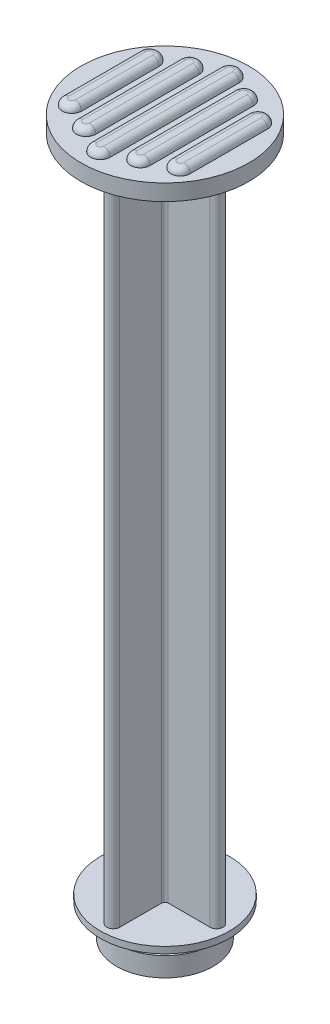
from build123d import *

# Parameters (mm, degrees)
BOSS_EXTRUDE1_DEPTH = 102
SKETCH3_R           = 13
BOSS_EXTRUDE2_DEPTH = 2.5
BOSS_EXTRUDE3_DEPTH = 1
FILLET1_R           = 1


with BuildPart() as part:
    # Sketch1 → Revolve1 (revolve)
    with BuildSketch(Plane.XY, mode=Mode.PRIVATE) as revolve1_sk:
        Polygon((0, 0), (7.5, 0), (7.5, 3), (6, 3), (6, 5), (10, 5), (10, 6), (0, 6), align=None)
    revolve(revolve1_sk.sketch.rotate(Axis((0, 6, 0), (0, -1, 0)), 180), axis=Axis((0, 6, 0), (0, -1, 0)))

    # Sketch2 → Boss-Extrude1 (add)
    with BuildSketch(Plane(origin=(0, 6, 0), x_dir=(1, 0, 0), z_dir=(0, 1, 0))):
        with BuildLine():
            Line((-1, 8), (-1, 1.5))
            ThreePointArc((-1, 1.5), (-1.146446609, 1.146446609), (-1.5, 1))
            Line((-1.5, 1), (-8, 1))
            ThreePointArc((-8, 1), (-9, 0), (-8, -1))
            Line((-8, -1), (-1.5, -1))
            ThreePointArc((-1.5, -1), (-1.146446609, -1.146446609), (-1, -1.5))
            Line((-1, -1.5), (-1, -8))
            ThreePointArc((-1, -8), (0, -9), (1, -8))
            Line((1, -8), (1, -1.5))
            ThreePointArc((1, -1.5), (1.146446609, -1.146446609), (1.5, -1))
            Line((1.5, -1), (8, -1))
            ThreePointArc((8, -1), (9, 0), (8, 1))
            Line((8, 1), (1.5, 1))
            ThreePointArc((1.5, 1), (1.146446609, 1.146446609), (1, 1.5))
            Line((1, 1.5), (1, 8))
            ThreePointArc((1, 8), (0, 9), (-1, 8))
        make_face()
    extrude(amount=BOSS_EXTRUDE1_DEPTH)

    # Sketch3 → Boss-Extrude2 (add)
    with BuildSketch(Plane(origin=(0, 108, 0), x_dir=(1, 0, 0), z_dir=(0, 1, 0))):
        with Locations(Location((0, 0, 0), (0, 0, 180))):
            Circle(SKETCH3_R)
    extrude(amount=BOSS_EXTRUDE2_DEPTH)

    # Sketch4 → Boss-Extrude3 (add)
    with BuildSketch(Plane(origin=(0, 110.5, 0), x_dir=(1, 0, 0), z_dir=(0, 1, 0))):
        with BuildLine():
            Line((-1.5, 10), (-1.5, -10))
            ThreePointArc((-1.5, -10), (0, -11.5), (1.5, -10))
            Line((1.5, -10), (1.5, 10))
            ThreePointArc((1.5, 10), (0, 11.5), (-1.5, 10))
        make_face()
        with BuildLine():
            Line((-5.7, 8), (-5.7, -8))
            ThreePointArc((-5.7, -8), (-4.2, -9.5), (-2.7, -8))
            Line((-2.7, -8), (-2.7, 8))
            ThreePointArc((-2.7, 8), (-4.2, 9.5), (-5.7, 8))
        make_face()
        with BuildLine():
            Line((-9.9, 6), (-9.9, -6))
            ThreePointArc((-9.9, -6), (-8.4, -7.5), (-6.9, -6))
            Line((-6.9, -6), (-6.9, 6))
            ThreePointArc((-6.9, 6), (-8.4, 7.5), (-9.9, 6))
        make_face()
        with BuildLine():
            Line((9.9, 6), (9.9, -6))
            ThreePointArc((9.9, -6), (8.4, -7.5), (6.9, -6))
            Line((6.9, -6), (6.9, 6))
            ThreePointArc((6.9, 6), (8.4, 7.5), (9.9, 6))
        make_face()
        with BuildLine():
            Line((5.7, 8), (5.7, -8))
            ThreePointArc((5.7, -8), (4.2, -9.5), (2.7, -8))
            Line((2.7, -8), (2.7, 8))
            ThreePointArc((2.7, 8), (4.2, 9.5), (5.7, 8))
        make_face()
    extrude(amount=BOSS_EXTRUDE3_DEPTH)

    # Fillet1
    fillet1_edges = [part.edges().sort_by_distance(p)[0] for p in [
        (9.9, 111.5, 0),
        (8.4, 111.5, 7.5),
        (6.9, 111.5, 0),
        (8.4, 111.5, -7.5),
        (5.7, 111.5, 0),
        (4.2, 111.5, 9.5),
        (2.7, 111.5, 0),
        (4.2, 111.5, -9.5),
        (1.5, 111.5, 0),
        (0, 111.5, 11.5),
        (-1.5, 111.5, 0),
        (0, 111.5, -11.5),
        (-2.7, 111.5, 0),
        (-4.2, 111.5, 9.5),
        (-5.7, 111.5, 0),
        (-4.2, 111.5, -9.5),
        (-6.9, 111.5, 0),
        (-8.4, 111.5, 7.5),
        (-9.9, 111.5, 0),
        (-8.4, 111.5, -7.5),
    ]]
    fillet(fillet1_edges, radius=FILLET1_R - 0.0001)  # a hair under: the kernel refuses the full size


solid = part.part
